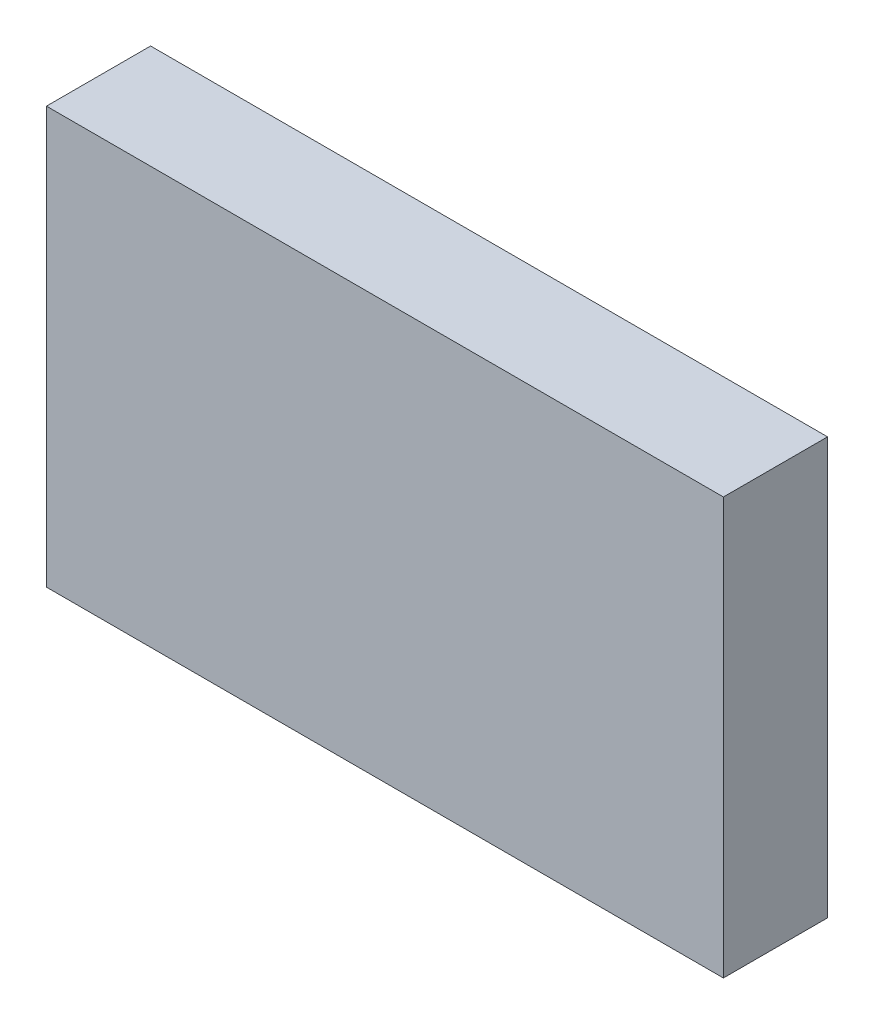
from build123d import *

# Parameters (mm, degrees)
BOSS_EXTRUDE1_DEPTH      = 200
BOSS_EXTRUDE1_DEPTH_BACK = 200
SKETCH2_W                = 650
SKETCH2_H                = 100


with BuildPart() as part:
    # Sketch2 → Boss-Extrude1 (new, two sides: drawn at the far end of the back side and taken through both)
    with BuildSketch(Plane(origin=(0, 0, 0), x_dir=(1, 0, 0), z_dir=(0, 1, 0)).offset(-BOSS_EXTRUDE1_DEPTH_BACK)):
        Rectangle(SKETCH2_W, SKETCH2_H)
    extrude(amount=BOSS_EXTRUDE1_DEPTH + BOSS_EXTRUDE1_DEPTH_BACK)


solid = part.part
